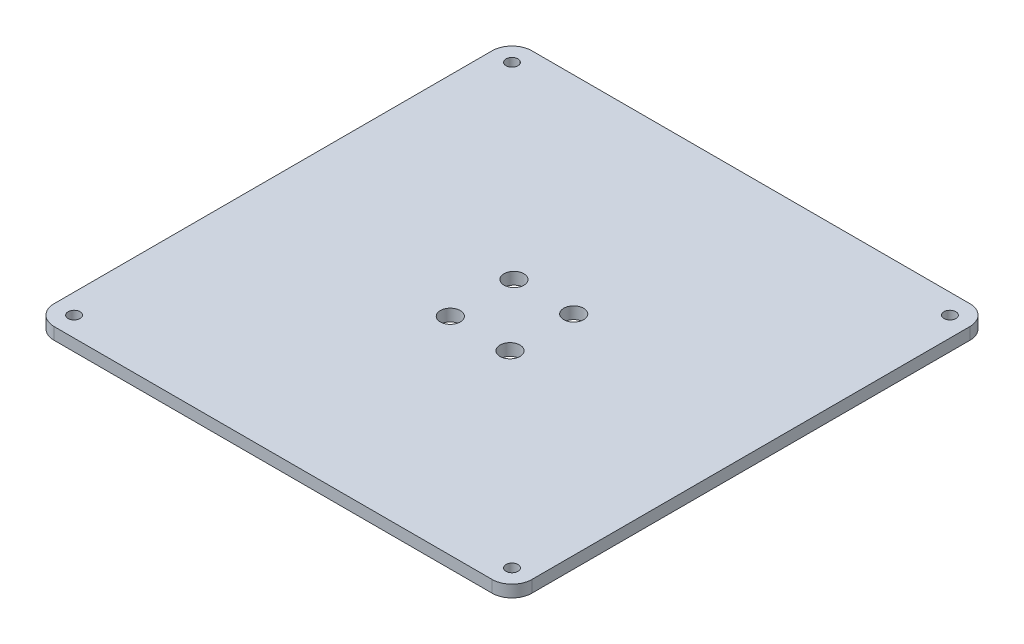
from build123d import *

# Parameters (mm, degrees)
SKETCH1_W                                  = 120
SKETCH1_H                                  = 120
SKETCH1_R                                  = 2.5
BOSS_EXTRUDE1_DEPTH                        = 3
FILLET1_R                                  = 5
SKETCH2_R                                  = 1.5
CUT_EXTRUDE1_DEPTH                         = 85.905830189
MIRROR3_AT_THE_SECOND_PLANE_COPY_1_SKETC_R = 1.5
MIRROR3_AT_THE_SECOND_PLANE_COPY_1_DEPTH   = 85.905830189


with BuildPart() as part:
    # Sketch1 → Boss-Extrude1 (new body)
    with BuildSketch(Plane(origin=(0, 0, 0), x_dir=(1, 0, 0), z_dir=(0, 1, 0))):
        Rectangle(SKETCH1_W, SKETCH1_H)
        with Locations((-7.5, -8)):
            Circle(SKETCH1_R, mode=Mode.SUBTRACT)
        with Locations((7.5, 8)):
            Circle(SKETCH1_R, mode=Mode.SUBTRACT)
        with Locations((7.5, -8)):
            Circle(SKETCH1_R, mode=Mode.SUBTRACT)
        with Locations((-7.5, 8)):
            Circle(SKETCH1_R, mode=Mode.SUBTRACT)
    extrude(amount=BOSS_EXTRUDE1_DEPTH)

    # Fillet1
    fillet1_edges = [part.edges().sort_by_distance(p)[0] for p in [
        (-60, 1.5, -60),
        (60, 1.5, -60),
        (60, 1.5, 60),
        (-60, 1.5, 60),
    ]]
    fillet(fillet1_edges, radius=FILLET1_R)

    # Sketch2 → Cut-Extrude1 (cut, through all)
    with BuildSketch(Plane(origin=(0, 3, 0), x_dir=(1, 0, 0), z_dir=(0, 1, 0))):
        with Locations((-55, 55)):
            Circle(SKETCH2_R)
    cut_extrude1 = extrude(amount=-CUT_EXTRUDE1_DEPTH, mode=Mode.SUBTRACT)

    # Mirror3: Cut-Extrude1 across plane
    add(cut_extrude1.mirror(Plane.XY), mode=Mode.SUBTRACT)

    # Mirror3 at the second plane: Cut-Extrude1 across plane
    add(cut_extrude1.mirror(Plane(origin=(0, 0, 0), x_dir=(0, 0, 1), z_dir=(1, 0, 0))), mode=Mode.SUBTRACT)

    # Mirror3 at the second plane copy 1 sketc → Mirror3 at the second plane copy 1 (cut, through all)
    with BuildSketch(Plane(origin=(0, 3, 0), x_dir=(-1, 0, 0), z_dir=(0, 1, 0))):
        with Locations((-55, 55)):
            Circle(MIRROR3_AT_THE_SECOND_PLANE_COPY_1_SKETC_R)
    extrude(amount=-MIRROR3_AT_THE_SECOND_PLANE_COPY_1_DEPTH, mode=Mode.SUBTRACT)


solid = part.part
